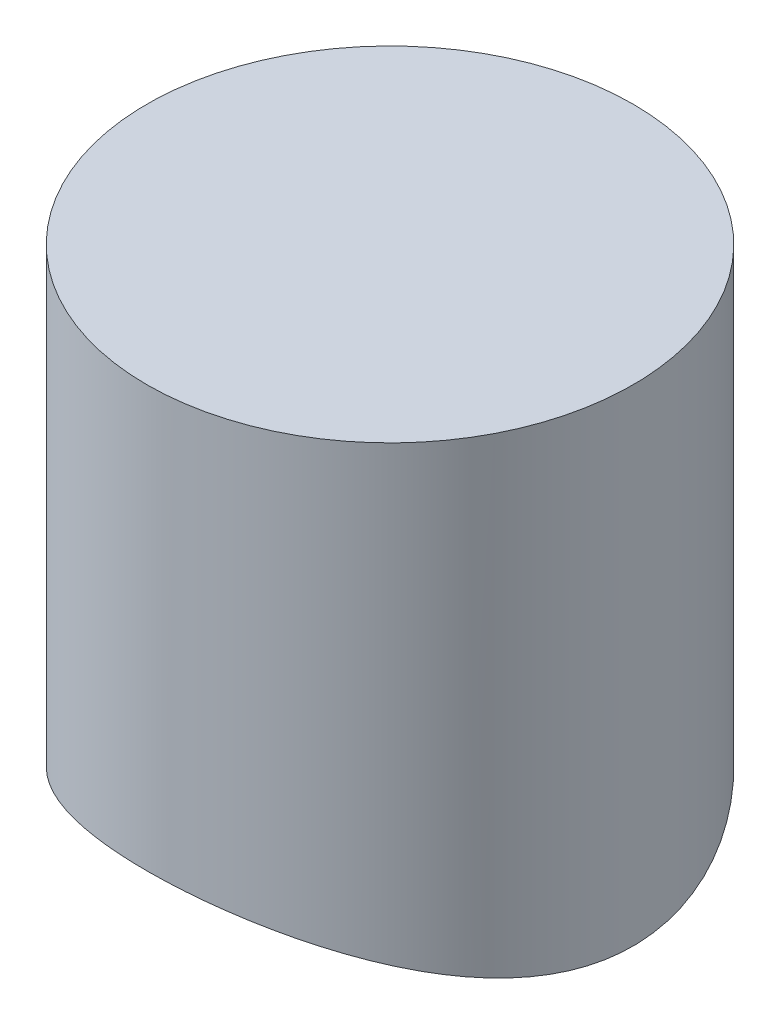
from build123d import *

# Parameters (mm, degrees)
SKETCH1_R               = 20
BOSS_EXTRUDE1_DEPTH     = 40
SKETCH2_R               = 10
CUT_EXTRUDE1_DEPTH      = 25
THREAD1_PITCH           = 4
CUT_EXTRUDE2_DEPTH      = 49.989794937
CUT_EXTRUDE2_DEPTH_BACK = 49.989794937
SKETCH3_R               = 40


with BuildPart() as part:
    # Sketch1 → Boss-Extrude1 (new body)
    with BuildSketch(Plane(origin=(0, 0, 0), x_dir=(1, 0, 0), z_dir=(0, 1, 0))):
        with Locations(Location((0, 0, 0), (0, 0, 270))):
            Circle(SKETCH1_R)
    extrude(amount=BOSS_EXTRUDE1_DEPTH)

    # Sketch2 → Cut-Extrude1 (cut)
    with BuildSketch(Plane.XZ):
        with Locations(Location((0, 0, 0), (0, 0, 270))):
            Circle(SKETCH2_R)
    extrude(amount=-CUT_EXTRUDE1_DEPTH, mode=Mode.SUBTRACT)

    # Thread1: the profile of Thread Profile1 profile screwed along a right-hand helix of 6.25 turns, 12 arcs to a turn; built about Z, then put on its axis
    thread1_z = Axis((0, 0, 0), (0, 0, 1))
    thread1_corners = [(10.0003, 0, -0.000173205), (10.0003, 0, 3.500173194), (7.8349365, 0, 2.249999995), (7.8349365, 0, 1.249999995)]
    with BuildLine(mode=Mode.PRIVATE) as thread1_profile:
        Line(thread1_corners[0], thread1_corners[1])
        Line(thread1_corners[1], thread1_corners[2])
        Line(thread1_corners[2], thread1_corners[3])
        Line(thread1_corners[3], thread1_corners[0])
    thread1_cap = Face(thread1_profile.wire())
    thread1_turn_angles = [0, 15, 30, 45, 60, 75, 90, 105, 120, 135, 150, 165, 180, 195, 210, 225, 240, 255, 270, 285, 300, 315, 330, 345, 360]
    thread1_turn_weights = [1, 0.9659258262890683, 1, 0.9659258262890683, 1, 0.9659258262890683, 1, 0.9659258262890683, 1, 0.9659258262890683, 1, 0.9659258262890683, 1, 0.9659258262890683, 1, 0.9659258262890683, 1, 0.9659258262890683, 1, 0.9659258262890683, 1, 0.9659258262890683, 1, 0.9659258262890683, 1]
    thread1_turn_rails = [Edge.make_bspline([Vector(p[0], p[1], 0).rotate(thread1_z, thread1_turn_angles[k]) / thread1_turn_weights[k] + Vector(0, 0, p[2] + THREAD1_PITCH * thread1_turn_angles[k] / 360) for k in range(25)], [0, 0, 0, 1, 1, 2, 2, 3, 3, 4, 4, 5, 5, 6, 6, 7, 7, 8, 8, 9, 9, 10, 10, 11, 11, 12, 12, 12], 2, thread1_turn_weights) for p in thread1_corners]
    thread1_turn_sides = [Face.make_surface_from_curves(thread1_turn_rails[p[0]], thread1_turn_rails[p[1]]) for p in [(0, 1), (1, 2), (2, 3), (3, 0)]]
    thread1_last_angles = [2160, 2175, 2190, 2205, 2220, 2235, 2250]
    thread1_last_weights = [1, 0.9659258262890683, 1, 0.9659258262890683, 1, 0.9659258262890683, 1]
    thread1_last_rails = [Edge.make_bspline([Vector(p[0], p[1], 0).rotate(thread1_z, thread1_last_angles[k]) / thread1_last_weights[k] + Vector(0, 0, p[2] + THREAD1_PITCH * thread1_last_angles[k] / 360) for k in range(7)], [0, 0, 0, 1, 1, 2, 2, 3, 3, 3], 2, thread1_last_weights) for p in thread1_corners]
    thread1_last_sides = [Face.make_surface_from_curves(thread1_last_rails[p[0]], thread1_last_rails[p[1]]) for p in [(0, 1), (1, 2), (2, 3), (3, 0)]]
    thread1 = Plane(origin=(0, 0, 0), x_dir=(1, 0, 0), z_dir=(0, 1, 0)) * Solid(Shell([*[p.moved(Location((0, 0, THREAD1_PITCH * i))) for i in range(6) for p in thread1_turn_sides], *thread1_last_sides, thread1_cap, thread1_cap.rotate(thread1_z, 2250).moved(Location((0, 0, THREAD1_PITCH * 2250 / 360)))]))
    add(thread1)

    # Sketch3 → Cut-Extrude2 (cut, two sides: drawn at the far end of the back side and taken through both)
    with BuildSketch(Plane.XY.offset(-CUT_EXTRUDE2_DEPTH_BACK)):
        with Locations((0, -34.641016151)):
            Circle(SKETCH3_R)
    extrude(amount=CUT_EXTRUDE2_DEPTH + CUT_EXTRUDE2_DEPTH_BACK, mode=Mode.SUBTRACT)


solid = part.part
